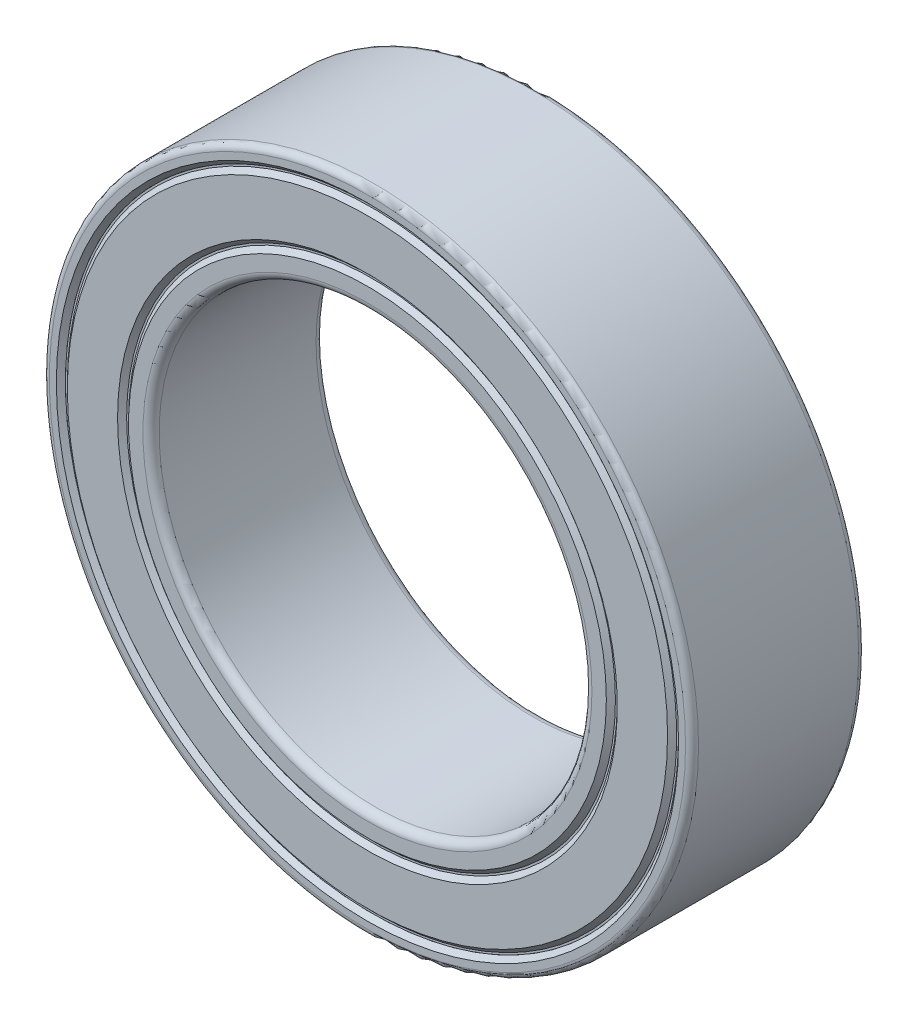
from build123d import *

# Parameters (mm, degrees)
SKETCH3_W         = 4
SKETCH3_H         = 0.416666667
SKETCH3_H_2       = 0.625
SKETCH4_R         = 0.875
CIRPATTERN1_COUNT = 7
FILLET1_R         = 0.15
FILLET2_R         = 0.1875
CHAMFER1_SIZE     = 0.105
CHAMFER2_SIZE     = 0.105


# Read off the part's stored shape, not the designer's step: Thicken1
with BuildPart() as part:
    # Sketch3 → Revolve1 (revolve)
    with BuildSketch(Plane(origin=(0, 0, 0), x_dir=(0, 0, -1), z_dir=(1, 0, 0)), mode=Mode.PRIVATE) as revolve1_sk:
        with Locations((0, -7.291666667)):
            Rectangle(SKETCH3_W, SKETCH3_H)
        with Locations((0, -5.3125)):
            Rectangle(SKETCH3_W, SKETCH3_H_2)
    revolve(revolve1_sk.sketch.rotate(Axis((0, 0, 2), (0, 0, -1)), 270), axis=Axis((0, 0, 2), (0, 0, -1)))

    # Sketch4 → Cut-Revolve1 (revolve, cut)
    with BuildSketch(Plane(origin=(0, 0, 0), x_dir=(0, 0, -1), z_dir=(1, 0, 0)), mode=Mode.PRIVATE) as cut_revolve1_sk:
        with Locations((0, -6.354166667)):
            Circle(SKETCH4_R)
    revolve(cut_revolve1_sk.sketch.rotate(Axis((0, 0, 2), (0, 0, -1)), 270), axis=Axis((0, 0, 2), (0, 0, -1)), mode=Mode.SUBTRACT)

    # Fillet1
    fillet1_edges = [part.edges().sort_by_distance(p)[0] for p in [
        (-7.5, 0, -2),
        (-7.5, 0, 2),
    ]]
    fillet(fillet1_edges, radius=FILLET1_R)

    # Fillet2
    fillet2_edges = [part.edges().sort_by_distance(p)[0] for p in [
        (-5, 0, -2),
        (-5, 0, 2),
    ]]
    fillet(fillet2_edges, radius=FILLET2_R)

    # Chamfer1
    chamfer1_edges = [part.edges().sort_by_distance(p)[0] for p in [
        (-7.083333333, 0, 2),
        (-7.083333333, 0, -2),
    ]]
    chamfer(chamfer1_edges, length=CHAMFER1_SIZE)

    # Chamfer2
    chamfer2_edges = [part.edges().sort_by_distance(p)[0] for p in [
        (-5.625, 0, 2),
        (-5.625, 0, -2),
    ]]
    chamfer(chamfer2_edges, length=CHAMFER2_SIZE)


with BuildPart() as body_2:
    # Sketch5 → Revolve2 (revolve)
    with BuildSketch(Plane(origin=(0, 0, 0), x_dir=(0, 0, -1), z_dir=(1, 0, 0))):
        with BuildLine():
            Line((0, -5.479166667), (0, -7.229166667))
            ThreePointArc((0, -7.229166667), (0.875, -6.354166667), (0, -5.479166667))
        make_face()
    revolve(axis=Axis((0, -5.479166667, 0), (0, -1, 0)))


with BuildPart() as cirpattern1_1:
    # CirPattern1: pattern copy
    add(body_2.part.rotate(Axis((0, 0, 0), (0, 0, 1)), 1 * 360 / CIRPATTERN1_COUNT))


with BuildPart() as cirpattern1_2:
    # CirPattern1: pattern copy
    add(body_2.part.rotate(Axis((0, 0, 0), (0, 0, 1)), 2 * 360 / CIRPATTERN1_COUNT))


with BuildPart() as cirpattern1_3:
    # CirPattern1: pattern copy
    add(body_2.part.rotate(Axis((0, 0, 0), (0, 0, 1)), 3 * 360 / CIRPATTERN1_COUNT))


with BuildPart() as cirpattern1_4:
    # CirPattern1: pattern copy
    add(body_2.part.rotate(Axis((0, 0, 0), (0, 0, 1)), 4 * 360 / CIRPATTERN1_COUNT))


with BuildPart() as cirpattern1_5:
    # CirPattern1: pattern copy
    add(body_2.part.rotate(Axis((0, 0, 0), (0, 0, 1)), 5 * 360 / CIRPATTERN1_COUNT))


with BuildPart() as cirpattern1_6:
    # CirPattern1: pattern copy
    add(body_2.part.rotate(Axis((0, 0, 0), (0, 0, 1)), 6 * 360 / CIRPATTERN1_COUNT))


with BuildPart() as body_9:
    # Thicken1 outline → Thicken1 (revolve)
    with BuildSketch(Plane.XZ):
        Polygon((5.625, 1.895), (5.625, 1.768), (5.721355122, 1.768), (5.826355122, 1.873), (6.881978211, 1.873), (6.986978211, 1.768), (7.083333333, 1.768), (7.083333333, 1.895), (7.039583333, 1.895), (6.934583333, 2), (5.77375, 2), (5.66875, 1.895), align=None)
    revolve(axis=Axis((0, 0, 0), (0, 0, 1)))


with BuildPart() as body_10:
    # Mirror1: mirrored copy
    add(body_9.part.mirror(Plane.XY))


solid = Compound([part.part, body_2.part, cirpattern1_1.part, cirpattern1_2.part, cirpattern1_3.part, cirpattern1_4.part, cirpattern1_5.part, cirpattern1_6.part, body_9.part, body_10.part])
